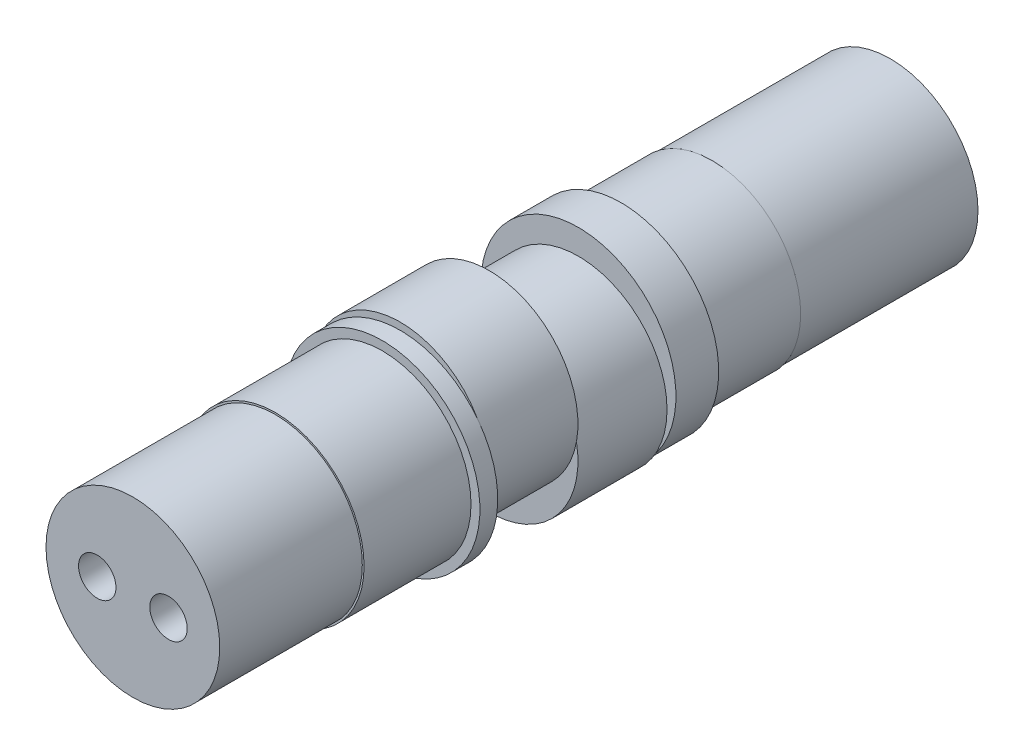
from build123d import *

# Parameters (mm, degrees)
SKETCH1_R                   = 9.95
CENTRAL_INPUT_JOURNAL_DEPTH = 7.5
SKETCH8_R                   = 10.95
RIM_DEPTH                   = 2
SKETCH2_R                   = 9.95
ECCENTRIC_JOURNAL_DEPTH     = 10
BACK_START                  = 2.8
SKETCH16_R                  = 10.95
BACK_RIM_EXTENSION_DEPTH    = 2.8
SKETCH4_R                   = 9.95
ECCENTRIC_JOURNAL_2_DEPTH   = 10
M4_BOLTS_HOLE_DEPTH         = 46.433632917
M4_BOLTS_HOLE_DEPTH_BACK    = 46.433632917
SKETCH7_R                   = 2.1
SKETCH12_W                  = 20
SKETCH12_H                  = 9.85
SKETCH15_R                  = 2.9
INPUTTHREADEDINSERTS_DEPTH  = 6
FRONTJOURNALEXTENSION_START = 15
SKETCH14_R                  = 9.95
SKETCH14_R_2                = 2.1
FRONTJOURNALEXTENSION_DEPTH = 15
SKETCH17_R                  = 9.95
SKETCH17_R_2                = 9.75
OUTPUTTHROUGH_DEPTH         = 16


# Read off the part's stored shape, not the designer's step: Split1
with BuildPart() as part:
    # Sketch1 → Central Input Journal (new, symmetric)
    with BuildSketch(Plane.XY):
        Circle(SKETCH1_R)
    extrude(amount=CENTRAL_INPUT_JOURNAL_DEPTH, both=True)

    # Sketch8 → Rim (add)
    with BuildSketch(Plane(origin=(0, 0, -7.5), x_dir=(-1, 0, 0), z_dir=(0, 0, -1))):
        Circle(SKETCH8_R)
    extrude(amount=-RIM_DEPTH)


with BuildPart() as body_2:
    # Sketch2 → Eccentric Journal (new body)
    with BuildSketch(Plane(origin=(0, 0, -7.5), x_dir=(-1, 0, 0), z_dir=(0, 0, -1))):
        with Locations((0, 1.8)):
            Circle(SKETCH2_R)
    extrude(amount=ECCENTRIC_JOURNAL_DEPTH)



with BuildPart() as body_3:
    # Central Journal Back: mirrored copy
    add(part.part.mirror(Plane(origin=(0, 1.8, -17.5), x_dir=(1, 0, 0), z_dir=(0, 0, -1))))

    # Sketch16 → Back Rim Extension (add)
    with BuildSketch(Plane(origin=(0, 0, -29.5), x_dir=(-1, 0, 0), z_dir=(0, 0, -1)).offset(BACK_START)):
        Circle(SKETCH16_R)
    extrude(amount=-BACK_RIM_EXTENSION_DEPTH)


with BuildPart() as body_2_1:
    add(body_2.part)

    add(body_3.part)  # Eccentric Journal 2 merges body 3
    # Sketch4 → Eccentric Journal 2 (add)
    with BuildSketch(Plane.XY.offset(-27.5)):
        with Locations(Location((0, -1.8, 0), (0, 0, 169.577549887))):
            Circle(SKETCH4_R)
    extrude(amount=ECCENTRIC_JOURNAL_2_DEPTH)


with BuildPart() as m4_bolts_hole_tool:
    # Sketch7 → M4 Bolts Hole (new, two sides: drawn at the far end of the back side and taken through both)
    with BuildSketch(Plane.XY.offset(-M4_BOLTS_HOLE_DEPTH_BACK)):
        with Locations((-4, 0)):
            Circle(SKETCH7_R)
        with Locations((4, 0)):
            Circle(SKETCH7_R)
    extrude(amount=M4_BOLTS_HOLE_DEPTH + M4_BOLTS_HOLE_DEPTH_BACK)


with BuildPart() as part_1:
    add(part.part)

    # M4 Bolts Hole: cut by m4_bolts_hole_tool
    add(m4_bolts_hole_tool.part, mode=Mode.SUBTRACT)

    # Sketch14 → FrontJournalExtension (add)
    with BuildSketch(Plane.XY.offset(7.5).offset(FRONTJOURNALEXTENSION_START)):
        with Locations(Location((0, 0, 0), (0, 0, 180))):
            Circle(SKETCH14_R)
        with Locations((4, 0)):
            Circle(SKETCH14_R_2, mode=Mode.SUBTRACT)
        with Locations((-4, 0)):
            Circle(SKETCH14_R_2, mode=Mode.SUBTRACT)
    extrude(amount=-FRONTJOURNALEXTENSION_DEPTH)

    # Sketch17 → OutputThrough (cut)
    with BuildSketch(Plane.XY.offset(22.5)):
        with Locations(Location((0, 0, 0), (0, 0, 180))):
            Circle(SKETCH17_R)
        Circle(SKETCH17_R_2, mode=Mode.SUBTRACT)
    extrude(amount=-OUTPUTTHROUGH_DEPTH, mode=Mode.SUBTRACT)


with BuildPart() as body_2_2:
    add(body_2_1.part)

    # M4 Bolts Hole: cut by m4_bolts_hole_tool
    add(m4_bolts_hole_tool.part, mode=Mode.SUBTRACT)

    # Sketch12 → Input Shaft (revolve)
    with BuildSketch(Plane(origin=(0, 0, 0), x_dir=(0, 0, -1), z_dir=(1, 0, 0)), mode=Mode.PRIVATE) as input_shaft_sk:
        with Locations((52.5, 4.925)):
            Rectangle(SKETCH12_W, SKETCH12_H)
    revolve(input_shaft_sk.sketch.rotate(Axis((0, 0, 15.306648382), (0, 0, -1)), 270), axis=Axis((0, 0, 15.306648382), (0, 0, -1)))

    # Sketch15 → InputThreadedInserts (cut)
    with BuildSketch(Plane(origin=(0, 0, -62.5), x_dir=(-1, 0, 0), z_dir=(0, 0, -1))):
        with Locations((-3.75, 3.75)):
            Circle(SKETCH15_R)
        with Locations((3.75, 3.75)):
            Circle(SKETCH15_R)
        with Locations((3.75, -3.75)):
            Circle(SKETCH15_R)
        with Locations((-3.75, -3.75)):
            Circle(SKETCH15_R)
    extrude(amount=-INPUTTHREADEDINSERTS_DEPTH, mode=Mode.SUBTRACT)


with BuildPart() as body_3_2:
    # Split1: the piece on the far side of the plane
    add(body_2_2.part)
    split(bisect_by=Plane.XY.offset(-27.5), keep=Keep.BOTTOM)


with BuildPart() as body_2_3:
    add(body_2_2.part)

    # Split1
    split(bisect_by=Plane.XY.offset(-27.5), keep=Keep.TOP)


solid = Compound([part_1.part, body_3_2.part, body_2_3.part])
